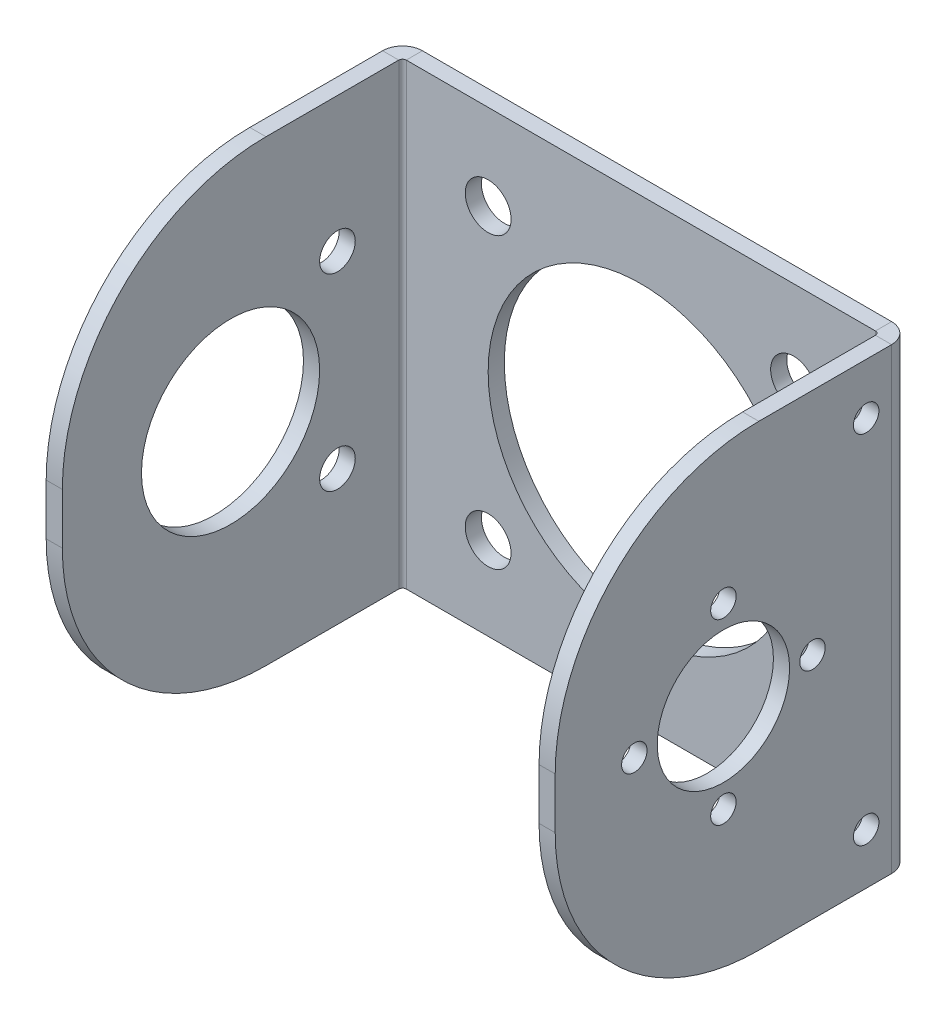
from build123d import *

# Parameters (mm, degrees)
CROQUIS22_W                        = 100
CROQUIS22_H                        = 90
BRIDA_BASE4_DEPTH                  = 3.175
BRIDA_DE_ARISTA1_STRIP_W           = 14.1732
BRIDA_DE_ARISTA1_STRIP_H           = 3.175
BRIDA_DE_ARISTA1_STRIP_CUT_DEPTH   = 90
BRIDA_DE_ARISTA1_STRIP_2_W         = 14.1732
BRIDA_DE_ARISTA1_STRIP_2_H         = 3.175
BRIDA_DE_ARISTA1_STRIP_CUT_2_DEPTH = 90
BRIDA_DE_ARISTA1_DEPTH             = 90
BRIDA_DE_ARISTA1_BEND_DEPTH        = 90
CROQUIS33_R                        = 8
CROQUIS33_R_2                      = 3.5
CORTAR_EXTRUIR3_DEPTH              = 14.7625
CROQUIS35_R                        = 13
CROQUIS35_R_2                      = 2.5
CORTAR_EXTRUIR4_DEPTH              = 14.7625
CROQUIS36_R                        = 17.5
CORTAR_EXTRUIR5_DEPTH              = 14.7625
CROQUIS37_R                        = 4.5
CROQUIS37_R_2                      = 30
CORTAR_EXTRUIR6_DEPTH              = 14.7625
REDONDEO1_R                        = 40
CROQUIS40_R                        = 2.5
CORTAR_EXTRUIR7_DEPTH              = 14.7625


# Sheet-metal steps are written as plain solids
with BuildPart() as part:
    # Croquis22 → Brida base4 (new body)
    with BuildSketch(Plane.XY):
        Rectangle(CROQUIS22_W, CROQUIS22_H)
    extrude(amount=-BRIDA_BASE4_DEPTH)

    # Brida de arista1 strip (across the edge) → Brida de arista1 strip cut (cut)
    with BuildSketch(Plane(origin=(-50, 45, 0), x_dir=(1, 0, 0), z_dir=(0, -1, 0))):
        with Locations((-3.175, -1.5875)):
            Rectangle(BRIDA_DE_ARISTA1_STRIP_W, BRIDA_DE_ARISTA1_STRIP_H)
    extrude(amount=BRIDA_DE_ARISTA1_STRIP_CUT_DEPTH, mode=Mode.SUBTRACT)

    # Brida de arista1 strip 2 (across the edge) → Brida de arista1 strip cut 2 (cut)
    with BuildSketch(Plane(origin=(50, -45, 0), x_dir=(-1, 0, 0), z_dir=(0, 1, 0))):
        with Locations((-3.175, -1.5875)):
            Rectangle(BRIDA_DE_ARISTA1_STRIP_2_W, BRIDA_DE_ARISTA1_STRIP_2_H)
    extrude(amount=BRIDA_DE_ARISTA1_STRIP_CUT_2_DEPTH, mode=Mode.SUBTRACT)

    # Brida de arista1 section (across the edge) → Brida de arista1 (add)
    with BuildSketch(Plane(origin=(-50, 45, 0), x_dir=(1, 0, 0), z_dir=(0, -1, 0))):
        with BuildLine():
            Line((0, 0.7366), (0, 66.825))
            Line((0, 66.825), (3.175, 66.825))
            Line((3.175, 66.825), (3.175, 0.7366))
            ThreePointArc((3.175, 0.7366), (3.390745145, 0.215745145), (3.9116, 0))
            Line((3.9116, 0), (3.9116, -3.175))
            ThreePointArc((3.9116, -3.175), (1.145681115, -2.029318885), (0, 0.7366))
        make_face()
    extrude(amount=BRIDA_DE_ARISTA1_DEPTH)

    # Brida de arista1 section 2 (across the edge) → Brida de arista1 bend (add)
    with BuildSketch(Plane(origin=(50, -45, 0), x_dir=(-1, 0, 0), z_dir=(0, 1, 0))):
        with BuildLine():
            Line((0, 0.7366), (0, 66.825))
            Line((0, 66.825), (3.175, 66.825))
            Line((3.175, 66.825), (3.175, 0.7366))
            ThreePointArc((3.175, 0.7366), (3.390745145, 0.215745145), (3.9116, 0))
            Line((3.9116, 0), (3.9116, -3.175))
            ThreePointArc((3.9116, -3.175), (1.145681115, -2.029318885), (0, 0.7366))
        make_face()
    extrude(amount=BRIDA_DE_ARISTA1_BEND_DEPTH)

    # Croquis33 → Cortar-Extruir3 (cut)
    with BuildSketch(Plane.ZY.offset(50)):
        with Locations((33.7808, 0)):
            Circle(CROQUIS33_R)
        with Locations((12.7808, 18.5)):
            Circle(CROQUIS33_R_2)
        with Locations((12.7808, -18.5)):
            Circle(CROQUIS33_R_2)
    extrude(amount=-CORTAR_EXTRUIR3_DEPTH, mode=Mode.SUBTRACT)

    # Croquis35 → Cortar-Extruir4 (cut)
    with BuildSketch(Plane(origin=(50, 0, 0), x_dir=(0, 0, -1), z_dir=(1, 0, 0))):
        with Locations((-33.7808, 0)):
            Circle(CROQUIS35_R)
        with Locations((-33.7808, 17.5)):
            Circle(CROQUIS35_R_2)
        with Locations((-33.7808, -17.5)):
            Circle(CROQUIS35_R_2)
        with Locations((-16.2808, 0)):
            Circle(CROQUIS35_R_2)
        with Locations((-51.2808, 0)):
            Circle(CROQUIS35_R_2)
    extrude(amount=-CORTAR_EXTRUIR4_DEPTH, mode=Mode.SUBTRACT)

    # Croquis36 → Cortar-Extruir5 (cut)
    with BuildSketch(Plane.ZY.offset(50)):
        with Locations((33.7808, 0)):
            Circle(CROQUIS36_R)
    extrude(amount=-CORTAR_EXTRUIR5_DEPTH, mode=Mode.SUBTRACT)

    # Croquis37 → Cortar-Extruir6 (cut)
    with BuildSketch(Plane.XY):
        with Locations((-30, 28.181524588)):
            Circle(CROQUIS37_R)
        with Locations((-30, -28.621860909)):
            Circle(CROQUIS37_R)
        with Locations((30, 28.181524588)):
            Circle(CROQUIS37_R)
        with Locations((30, -28.621860909)):
            Circle(CROQUIS37_R)
        Circle(CROQUIS37_R_2)
    extrude(amount=-CORTAR_EXTRUIR6_DEPTH, mode=Mode.SUBTRACT)

    # Redondeo1
    redondeo1_edges = [part.edges().sort_by_distance(p)[0] for p in [
        (-48.4125, 45, 66.825),
        (-48.4125, -45, 66.825),
        (48.4125, -45, 66.825),
        (48.4125, 45, 66.825),
    ]]
    fillet(redondeo1_edges, radius=REDONDEO1_R)

    # Croquis40 → Cortar-Extruir7 (cut)
    with BuildSketch(Plane(origin=(50, 0, 0), x_dir=(0, 0, -1), z_dir=(1, 0, 0))):
        with Locations((-5.7366, 35)):
            Circle(CROQUIS40_R)
        with Locations((-5.7366, -35)):
            Circle(CROQUIS40_R)
    extrude(amount=-CORTAR_EXTRUIR7_DEPTH, mode=Mode.SUBTRACT)


solid = part.part
